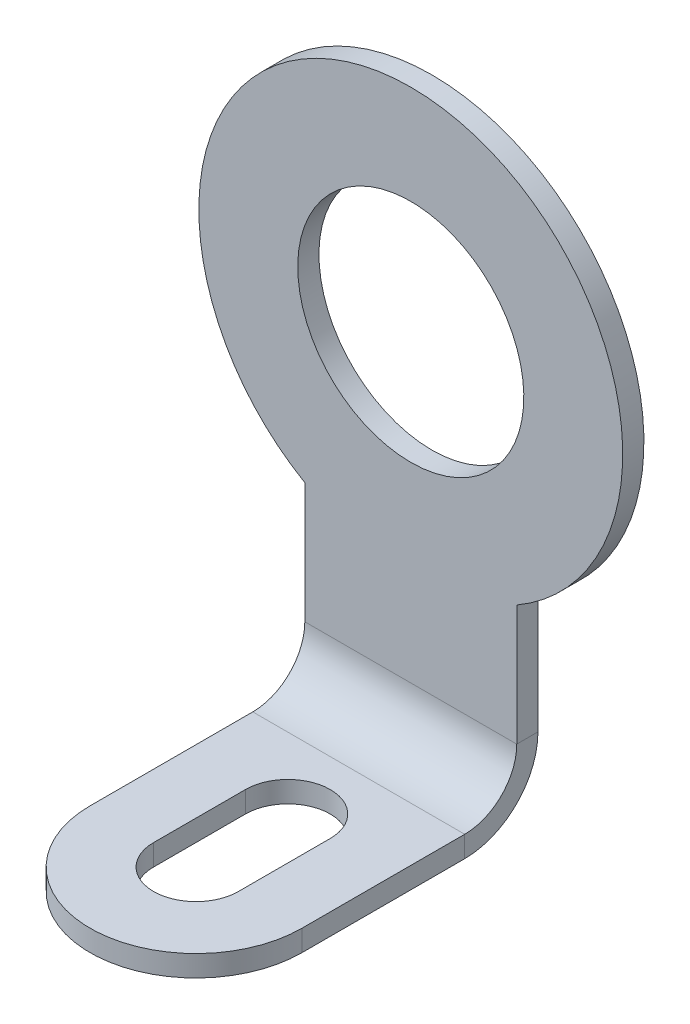
from build123d import *

# Parameters (mm, degrees)
SKETCH_1_R             = 1.6
SM_BASE_FLANGE_1_DEPTH = 0.3
OTHER_START            = -4
OTHER_1_OUTLINE_W      = 3
OTHER_1_OUTLINE_H      = 0.3
OTHER_1_DEPTH          = 8.959734012
OTHER_START_2          = 4.659734012
OTHER_1_2_OUTLINE_R    = 1.6
OTHER_1_2_DEPTH        = 1.0366
OTHER_1_3_DEPTH        = 8


with BuildPart() as part:
    # 基体-法兰1: sheet metal written as solids
    # Sketch 1 → 基体-法兰1 (new body)
    with BuildSketch(Plane(origin=(0, 0, 0), x_dir=(1, 0, 0), z_dir=(0, 1, 0))):
        with BuildLine():
            Line((-1.5, -8), (-1.5, -2.598076211))
            ThreePointArc((-1.5, -2.598076211), (0, 3), (1.5, -2.598076211))
            Line((1.5, -2.598076211), (1.5, -8))
            ThreePointArc((1.5, -8), (0, -9.5), (-1.5, -8))
        make_face()
        with Locations(Location((0, 0, 0), (0, 0, 270))):
            Circle(SKETCH_1_R, mode=Mode.SUBTRACT)
        with BuildLine():
            Line((0.6, -6.7), (0.6, -8))
            ThreePointArc((0.6, -8), (0, -8.6), (-0.6, -8))
            Line((-0.6, -8), (-0.6, -6.7))
            ThreePointArc((-0.6, -6.7), (0, -6.1), (0.6, -6.7))
        make_face(mode=Mode.SUBTRACT)
    extrude(amount=-SM_BASE_FLANGE_1_DEPTH)

    # Other 1: read off the stored shape, not the designer's step
    # Other 1 outline → Other 1 (cut)
    with BuildSketch(Plane.XY.offset(OTHER_START)):
        with Locations((0, -0.15)):
            Rectangle(OTHER_1_OUTLINE_W, OTHER_1_OUTLINE_H)
    extrude(amount=OTHER_1_DEPTH, mode=Mode.SUBTRACT)

    # Other 1 2 outline → Other 1 2 (add)
    with BuildSketch(Plane.XY.offset(OTHER_START_2)):
        with BuildLine():
            ThreePointArc((1.5, 2.442189777), (0, 8.040265988), (-1.5, 2.442189777))
            Line((-1.5, 2.442189777), (-1.5, 0))
            Line((-1.5, 0), (1.5, 0))
            Line((1.5, 0), (1.5, 2.442189777))
        make_face()
        with Locations((0, 5.040265988)):
            Circle(OTHER_1_2_OUTLINE_R, mode=Mode.SUBTRACT)
    extrude(amount=OTHER_1_2_DEPTH)

    # Other 1 3 outline → Other 1 3 (cut)
    with BuildSketch(Plane.YZ.offset(OTHER_START)):
        with BuildLine():
            Line((0.7366, 4.959734012), (10, 4.959734012))
            Line((10, 4.959734012), (10, 5.696334012))
            Line((10, 5.696334012), (0, 5.696334012))
            ThreePointArc((0, 5.696334012), (0.215745145, 5.175479157), (0.7366, 4.959734012))
        make_face()
        with BuildLine():
            Line((10, -4), (10, 4.659734016))
            Line((10, 4.659734016), (0.7366, 4.659734012))
            ThreePointArc((0.7366, 4.659734012), (0.00361311, 4.963347123), (-0.3, 5.696334012))
            Line((-0.3, 5.696334012), (-0.3, 7))
            Line((-0.3, 7), (-2, 7))
            Line((-2, 7), (-2, -4))
            Line((-2, -4), (10, -4))
        make_face()
    extrude(amount=OTHER_1_3_DEPTH, mode=Mode.SUBTRACT)


solid = part.part
